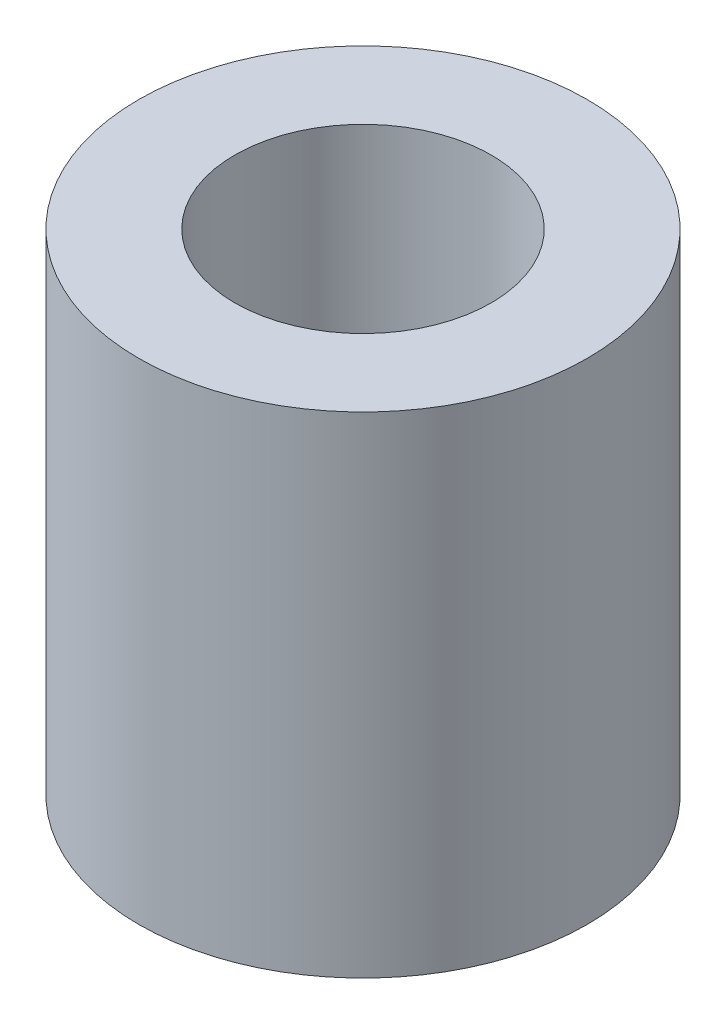
from build123d import *

# Parameters (mm, degrees)
SKETCH2_R           = 5.335
SKETCH2_R_2         = 3.05
BOSS_EXTRUDE1_DEPTH = 11.666


with BuildPart() as part:
    # Sketch2 → Boss-Extrude1 (new body)
    with BuildSketch(Plane(origin=(0, 0, 0), x_dir=(1, 0, 0), z_dir=(0, 1, 0))):
        Circle(SKETCH2_R)
        Circle(SKETCH2_R_2, mode=Mode.SUBTRACT)
    extrude(amount=BOSS_EXTRUDE1_DEPTH)


solid = part.part
